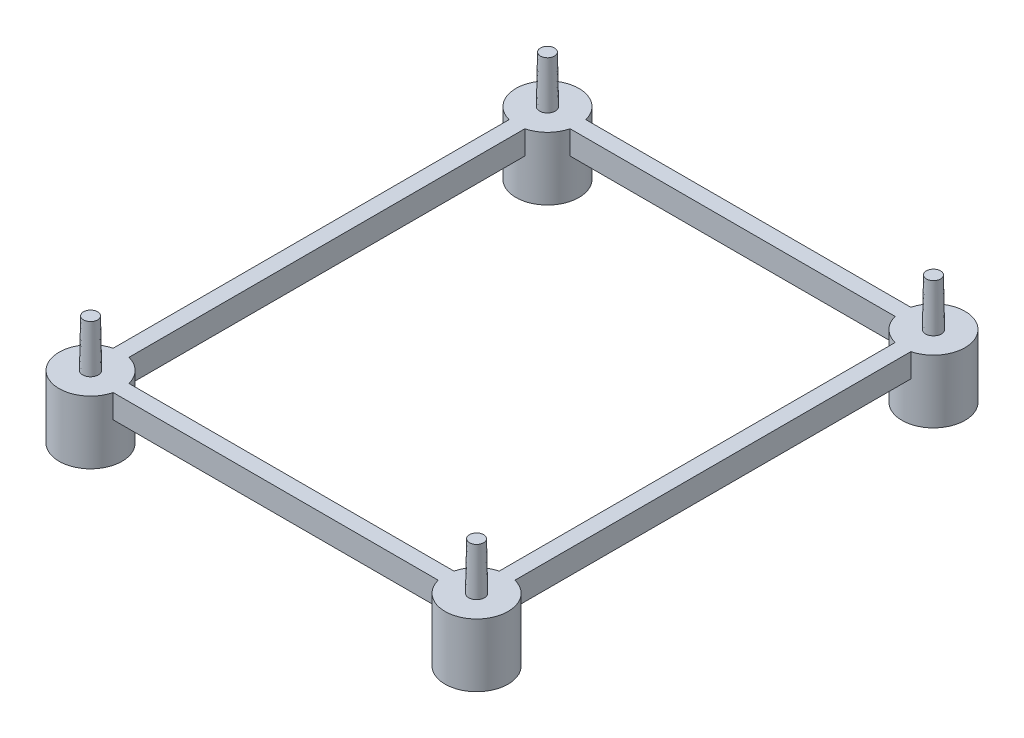
from build123d import *

# Parameters (mm, degrees)
SKETCH1_W                     = 47
SKETCH1_H                     = 56
BOSS_EXTRUDE1_DEPTH           = 3
SKETCH2_R                     = 1
BOSS_EXTRUDE2_DEPTH           = 6
BOSS_EXTRUDE2_DRAFT           = 1
BOSS_EXTRUDE2_PROFILE_2_DEPTH = 6
BOSS_EXTRUDE2_PROFILE_2_DRAFT = 1
BOSS_EXTRUDE2_PROFILE_3_DEPTH = 6
BOSS_EXTRUDE2_PROFILE_3_DRAFT = 1
BOSS_EXTRUDE2_PROFILE_4_DEPTH = 6
BOSS_EXTRUDE2_PROFILE_4_DRAFT = 1
BOSS_EXTRUDE3_DEPTH           = 5
BOSS_EXTRUDE3_DEPTH_BACK      = 3
SKETCH3_R                     = 4
SKETCH4_R                     = 3.1
CUT_EXTRUDE1_DEPTH            = 4


with BuildPart() as part:
    # Sketch1 → Boss-Extrude1 (new body)
    with BuildSketch(Plane(origin=(0, 0, 0), x_dir=(1, 0, 0), z_dir=(0, 1, 0))):
        with BuildLine():
            Line((2.5, 80), (2.5, 22))
            ThreePointArc((2.5, 22), (2.792893219, 21.292893219), (3.5, 21))
            Line((3.5, 21), (52.5, 21))
            ThreePointArc((52.5, 21), (53.207106781, 21.292893219), (53.5, 22))
            Line((53.5, 22), (53.5, 80))
            ThreePointArc((53.5, 80), (53.207106781, 80.707106781), (52.5, 81))
            Line((52.5, 81), (3.5, 81))
            ThreePointArc((3.5, 81), (2.792893219, 80.707106781), (2.5, 80))
        make_face()
        with Locations((28, 51)):
            Rectangle(SKETCH1_W, SKETCH1_H, mode=Mode.SUBTRACT)
    extrude(amount=BOSS_EXTRUDE1_DEPTH)


with BuildPart() as boss_extrude2_tool:
    # Sketch2 → Boss-Extrude2 (with draft: the straight prism first)
    with BuildSketch(Plane(origin=(0, 3, 0), x_dir=(1, 0, 0), z_dir=(0, 1, 0))):
        with Locations((3.5, 80)):
            Circle(SKETCH2_R)
    extrude(amount=BOSS_EXTRUDE2_DEPTH)
    # Boss-Extrude2: the draft: its side faces are tilted about the plane it starts from
    boss_extrude2_sides = [boss_extrude2_tool.faces().sort_by_distance(p)[0] for p in [
        (2.5, 6, -80),
    ]]
    draft(boss_extrude2_sides, Plane(origin=(0, 3, 0), x_dir=(1, 0, 0), z_dir=(0, 1, 0)), BOSS_EXTRUDE2_DRAFT)


with BuildPart() as part_1:
    add(part.part)

    # Boss-Extrude2: add boss_extrude2_tool
    add(boss_extrude2_tool.part)


with BuildPart() as boss_extrude2_profile_2_tool:
    # Sketch2 → Boss-Extrude2 profile 2 (with draft: the straight prism first)
    with BuildSketch(Plane(origin=(0, 3, 0), x_dir=(1, 0, 0), z_dir=(0, 1, 0))):
        with Locations((52.5, 80)):
            Circle(SKETCH2_R)
    extrude(amount=BOSS_EXTRUDE2_PROFILE_2_DEPTH)
    # Boss-Extrude2 profile 2: the draft: its side faces are tilted about the plane it starts from
    boss_extrude2_profile_2_sides = [boss_extrude2_profile_2_tool.faces().sort_by_distance(p)[0] for p in [
        (51.5, 6, -80),
    ]]
    draft(boss_extrude2_profile_2_sides, Plane(origin=(0, 3, 0), x_dir=(1, 0, 0), z_dir=(0, 1, 0)), BOSS_EXTRUDE2_PROFILE_2_DRAFT)


with BuildPart() as part_2:
    add(part_1.part)

    # Boss-Extrude2 profile 2: add boss_extrude2_profile_2_tool
    add(boss_extrude2_profile_2_tool.part)


with BuildPart() as boss_extrude2_profile_3_tool:
    # Sketch2 → Boss-Extrude2 profile 3 (with draft: the straight prism first)
    with BuildSketch(Plane(origin=(0, 3, 0), x_dir=(1, 0, 0), z_dir=(0, 1, 0))):
        with Locations((52.5, 22)):
            Circle(SKETCH2_R)
    extrude(amount=BOSS_EXTRUDE2_PROFILE_3_DEPTH)
    # Boss-Extrude2 profile 3: the draft: its side faces are tilted about the plane it starts from
    boss_extrude2_profile_3_sides = [boss_extrude2_profile_3_tool.faces().sort_by_distance(p)[0] for p in [
        (51.5, 6, -22),
    ]]
    draft(boss_extrude2_profile_3_sides, Plane(origin=(0, 3, 0), x_dir=(1, 0, 0), z_dir=(0, 1, 0)), BOSS_EXTRUDE2_PROFILE_3_DRAFT)


with BuildPart() as part_3:
    add(part_2.part)

    # Boss-Extrude2 profile 3: add boss_extrude2_profile_3_tool
    add(boss_extrude2_profile_3_tool.part)


with BuildPart() as boss_extrude2_profile_4_tool:
    # Sketch2 → Boss-Extrude2 profile 4 (with draft: the straight prism first)
    with BuildSketch(Plane(origin=(0, 3, 0), x_dir=(1, 0, 0), z_dir=(0, 1, 0))):
        with Locations((3.5, 22)):
            Circle(SKETCH2_R)
    extrude(amount=BOSS_EXTRUDE2_PROFILE_4_DEPTH)
    # Boss-Extrude2 profile 4: the draft: its side faces are tilted about the plane it starts from
    boss_extrude2_profile_4_sides = [boss_extrude2_profile_4_tool.faces().sort_by_distance(p)[0] for p in [
        (2.5, 6, -22),
    ]]
    draft(boss_extrude2_profile_4_sides, Plane(origin=(0, 3, 0), x_dir=(1, 0, 0), z_dir=(0, 1, 0)), BOSS_EXTRUDE2_PROFILE_4_DRAFT)


with BuildPart() as part_4:
    add(part_3.part)

    # Boss-Extrude2 profile 4: add boss_extrude2_profile_4_tool
    add(boss_extrude2_profile_4_tool.part)

    # Sketch3 → Boss-Extrude3 (add, two sides: drawn at the far end of the back side and taken through both)
    with BuildSketch(Plane.XZ.offset(-BOSS_EXTRUDE3_DEPTH_BACK)):
        with Locations((3.5, -22)):
            Circle(SKETCH3_R)
        with Locations((52.5, -22)):
            Circle(SKETCH3_R)
        with Locations((52.5, -80)):
            Circle(SKETCH3_R)
        with Locations((3.5, -80)):
            Circle(SKETCH3_R)
    extrude(amount=BOSS_EXTRUDE3_DEPTH + BOSS_EXTRUDE3_DEPTH_BACK)

    # Sketch4 → Cut-Extrude1 (cut)
    with BuildSketch(Plane.XZ.offset(5)):
        with Locations((3.5, -22)):
            Circle(SKETCH4_R)
        with Locations((52.5, -22)):
            Circle(SKETCH4_R)
        with Locations((3.5, -80)):
            Circle(SKETCH4_R)
        with Locations((52.5, -80)):
            Circle(SKETCH4_R)
    extrude(amount=-CUT_EXTRUDE1_DEPTH, mode=Mode.SUBTRACT)


solid = part_4.part
